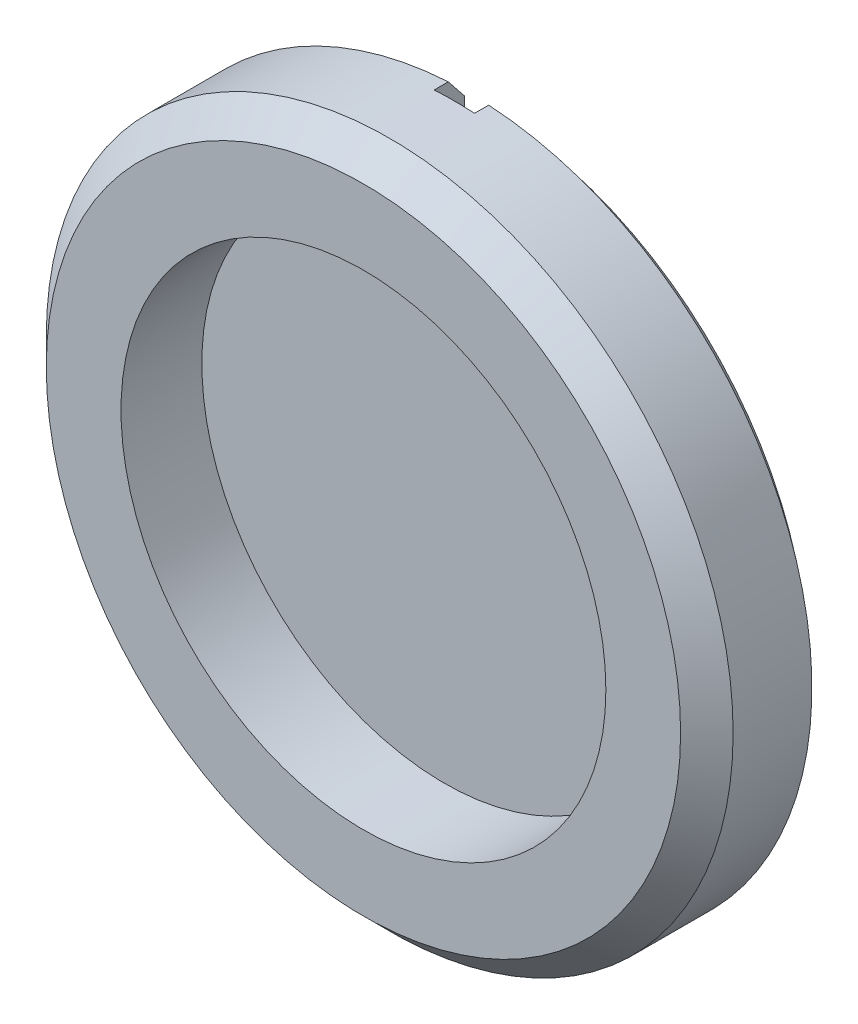
from build123d import *

# Parameters (mm, degrees)
ESQUISSE1_R             = 8.5
BOSS_EXTRU_1_DEPTH      = 3
ESQUISSE4_R             = 6
ENL_V_MAT_EXTRU_1_DEPTH = 2
ESQUISSE5_W             = 1
ESQUISSE5_H             = 17
ENL_V_MAT_EXTRU_2_DEPTH = 0.75


with BuildPart() as part:
    # Esquisse1 → Boss.-Extru.1 (new body)
    with BuildSketch(Plane.XY):
        Circle(ESQUISSE1_R)
    extrude(amount=BOSS_EXTRU_1_DEPTH)

    # Esquisse4 → Enlèv. mat.-Extru.1 (cut)
    with BuildSketch(Plane.XY.offset(3)):
        Circle(ESQUISSE4_R)
    extrude(amount=-ENL_V_MAT_EXTRU_1_DEPTH, mode=Mode.SUBTRACT)

    # Esquisse5 → Enlèv. mat.-Extru.2 (cut)
    with BuildSketch(Plane(origin=(0, 0, 0), x_dir=(-1, 0, 0), z_dir=(0, 0, -1))):
        Rectangle(ESQUISSE5_W, ESQUISSE5_H)
    extrude(amount=-ENL_V_MAT_EXTRU_2_DEPTH, mode=Mode.SUBTRACT)

    # Esquisse6 → Enlèvement de matière-Révolution1 (revolve, cut)
    with BuildSketch(Plane(origin=(0, 0, 0), x_dir=(1, 0, 0), z_dir=(0, 1, 0))):
        Polygon((-8, 0), (-8.5, -0.4), (-8.5, 0), align=None)
        Polygon((-8.5, -2.35), (-7.85, -3), (-8.5, -3), align=None)
    revolve(axis=Axis((0, 0, 0), (0, 0, 1)), mode=Mode.SUBTRACT)


solid = part.part
